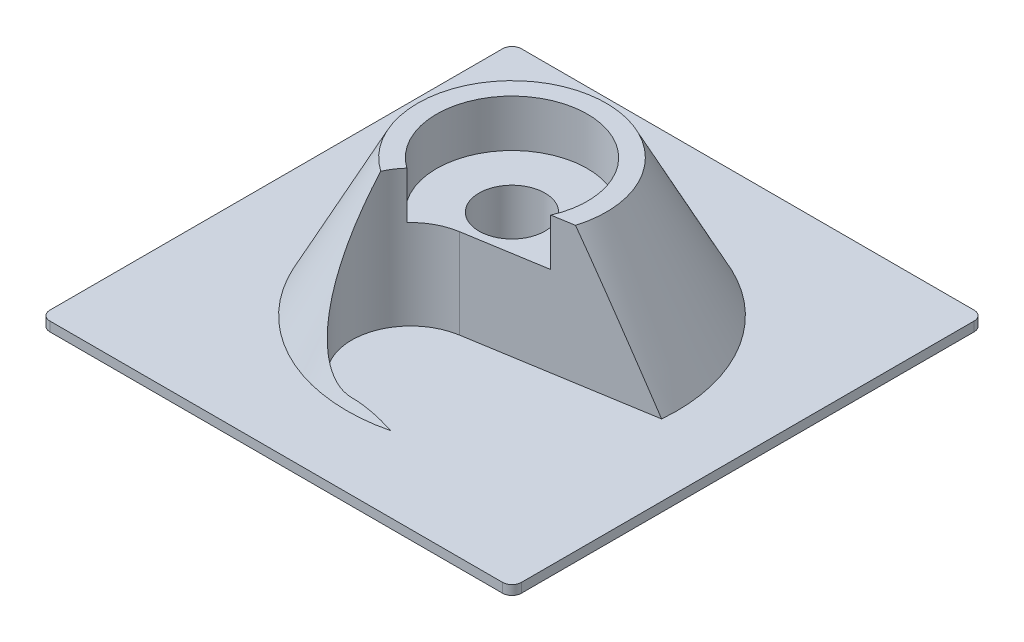
from build123d import *
from build123d.topology import SkipClean

# Parameters (mm, degrees)
BOSS_EXTRUDE1_DEPTH      = 0.5
BOSS_EXTRUDE1_DEPTH_BACK = 0.5
SKETCH1_R                = 3.5
CUT_EXTRUDE1_DEPTH       = 14.5


with BuildPart() as part:
    # Sketch1 → Boss-Extrude1 (new, two sides: drawn at the far end of the back side and taken through both)
    with BuildSketch(Plane(origin=(0, 0, 0), x_dir=(1, 0, 0), z_dir=(0, 1, 0)).offset(-BOSS_EXTRUDE1_DEPTH_BACK)):
        with BuildLine():
            Line((-24, 25), (24, 25))
            ThreePointArc((24, 25), (24.707106781, 24.707106781), (25, 24))
            Line((25, 24), (25, -24))
            ThreePointArc((25, -24), (24.707106781, -24.707106781), (24, -25))
            Line((24, -25), (-24, -25))
            ThreePointArc((-24, -25), (-24.707106781, -24.707106781), (-25, -24))
            Line((-25, -24), (-25, 24))
            ThreePointArc((-25, 24), (-24.707106781, 24.707106781), (-24, 25))
        make_face()
        with Locations(Location((0, 0, 0), (0, 0, 270))):
            Circle(SKETCH1_R, mode=Mode.SUBTRACT)
    extrude(amount=BOSS_EXTRUDE1_DEPTH + BOSS_EXTRUDE1_DEPTH_BACK)

    # Sketch2 → Revolve1 (revolve)
    with SkipClean():  # the faces are left unmerged after this step: merging them gives an invalid solid
        with BuildSketch(Plane.XY, mode=Mode.PRIVATE) as revolve1_sk:
            Polygon((-8, 15), (-10, 15), (-17.5, 0.5), (-3.5, 0.5), (-3.5, 10), (-8, 10), align=None)
        revolve(revolve1_sk.sketch.rotate(Axis((0, 0.5, 0), (0, 1, 0)), 180), axis=Axis((0, 0.5, 0), (0, 1, 0)))
    add(part.part.scale(1), mode=Mode.REPLACE)  # the faces are merged on a copy

    # Sketch4 → Cut-Extrude1 (cut)
    with BuildSketch(Plane(origin=(0, 15, 0), x_dir=(1, 0, 0), z_dir=(0, 1, 0))):
        with BuildLine():
            Line((25, -0.324292046), (-1.009690159, -4.582097133))
            ThreePointArc((-1.009690159, -4.582097133), (-6.229441906, -11.256511144), (0, -17))
            Line((0, -17), (25, -17))
            Line((25, -17), (25, -7.125))
            Line((25, -7.125), (25, -0.324292046))
        make_face()
    extrude(amount=-CUT_EXTRUDE1_DEPTH, mode=Mode.SUBTRACT)


solid = part.part
